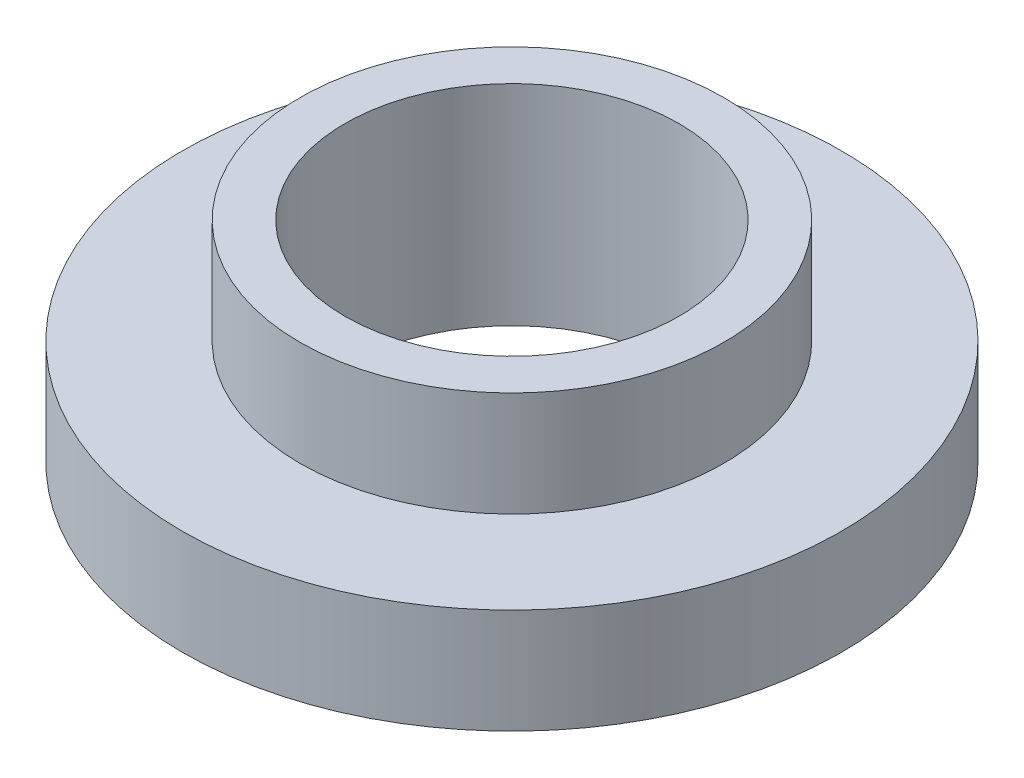
from build123d import *

# Parameters (mm, degrees)
SKETCH1_R           = 22
SKETCH1_R_2         = 11.15
BOSS_EXTRUDE1_DEPTH = 7
SKETCH2_R           = 14.15
SKETCH2_R_2         = 11.15
BOSS_EXTRUDE2_DEPTH = 7


with BuildPart() as part:
    # Sketch1 → Boss-Extrude1 (new body)
    with BuildSketch(Plane(origin=(0, 0, 0), x_dir=(1, 0, 0), z_dir=(0, 1, 0))):
        Circle(SKETCH1_R)
        Circle(SKETCH1_R_2, mode=Mode.SUBTRACT)
    extrude(amount=BOSS_EXTRUDE1_DEPTH)

    # Sketch2 → Boss-Extrude2 (add)
    with BuildSketch(Plane(origin=(0, 7, 0), x_dir=(1, 0, 0), z_dir=(0, 1, 0))):
        Circle(SKETCH2_R)
        Circle(SKETCH2_R_2, mode=Mode.SUBTRACT)
    extrude(amount=BOSS_EXTRUDE2_DEPTH)


solid = part.part
